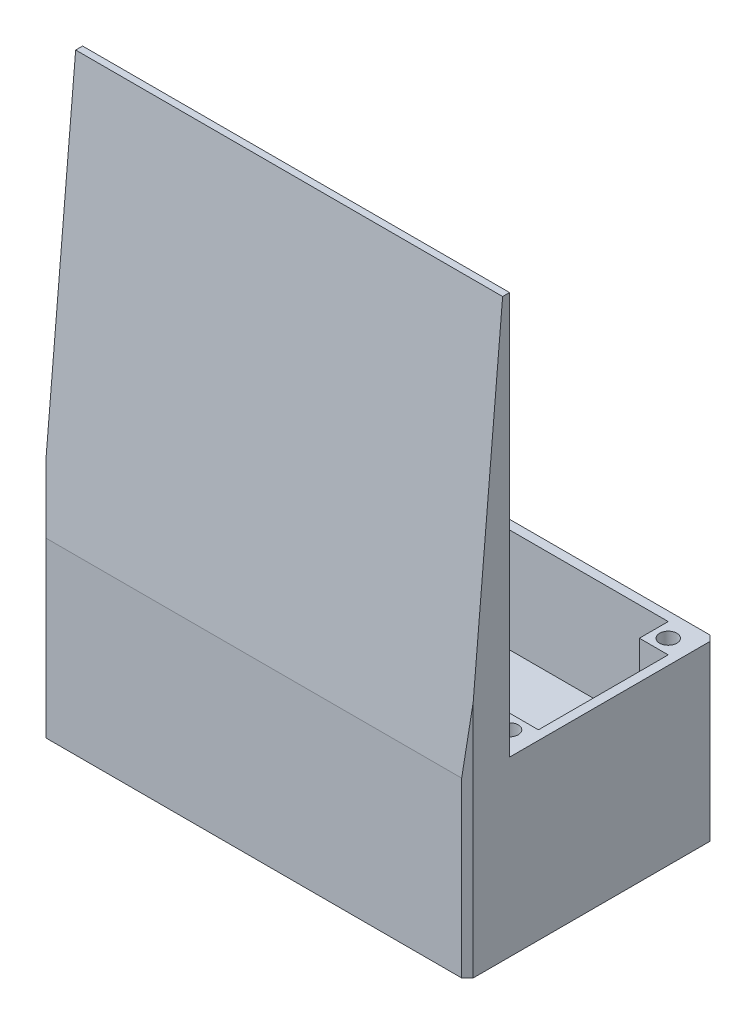
from build123d import *

# Parameters (mm, degrees)
SKETCH_1_W          = 74
SKETCH_1_H          = 43
EXTRUDE_1_DEPTH     = 30
EXTRUDE_4_DEPTH     = 74
CUT_EXTRUDE_2_REACH = 115.492
SKETCH_8_W          = 67
SKETCH_8_H          = 67
SKETCH_10_W         = 70.8
SKETCH_10_H         = 32.499098008
CUT_EXTRUDE_3_DEPTH = 18
CUT_EXTRUDE_5_REACH = 114.206
SKETCH_11_W         = 67
SKETCH_11_H         = 1.389705156
SKETCH_12_W         = 5
SKETCH_12_H         = 5
SKETCH_12_R         = 1.5
EXTRUDE_6_DEPTH     = 18
CHAMFER_1_SIZE      = 1


with BuildPart() as part:
    # 草图1 → 凸台-拉伸1 (new body)
    with BuildSketch(Plane(origin=(0, 0, 0), x_dir=(1, 0, 0), z_dir=(0, 1, 0))):
        Rectangle(SKETCH_1_W, SKETCH_1_H)
    extrude(amount=EXTRUDE_1_DEPTH)

    # 草图7 → 凸台-拉伸4 (add, through all)
    with BuildSketch(Plane.ZY.offset(37)):
        Polygon((21.5, 30), (15.399098008, 99.733628866), (14.199098008, 99.733628866), (14.199098008, 30), align=None)
    extrude(amount=-EXTRUDE_4_DEPTH)

    # 切除-拉伸2: up to this plane
    cut_extrude_2_end = Plane(origin=(37, 99.733628866, 14.199098008), z_dir=(0, 0, -1))
    # 草图8 → 切除-拉伸2 (cut, up to the surface)
    with BuildSketch(Plane(origin=(0, 1.990014723, 22.745972372), x_dir=(1, 0, 0), z_dir=(0, 0.08715574274766194, 0.9961946980917453)), mode=Mode.PRIVATE) as cut_extrude_2_sk1:
        with Locations((0, 63.011992474)):
            Rectangle(SKETCH_8_W, SKETCH_8_H)
    cut_extrude_2_tool1 = split(extrude(cut_extrude_2_sk1.sketch, amount=-CUT_EXTRUDE_2_REACH, mode=Mode.PRIVATE), bisect_by=cut_extrude_2_end, keep=Keep.BOTH, mode=Mode.PRIVATE)
    add(cut_extrude_2_tool1.solids().sort_by_distance((0, 64.762228, 17.254115))[0], mode=Mode.SUBTRACT)

    # 草图10 → 切除-拉伸3 (cut)
    with BuildSketch(Plane(origin=(0, 30, 0), x_dir=(1, 0, 0), z_dir=(0, 1, 0))):
        with Locations((0, 3.650450996)):
            Rectangle(SKETCH_10_W, SKETCH_10_H)
    extrude(amount=-CUT_EXTRUDE_3_DEPTH, mode=Mode.SUBTRACT)

    # 切除-拉伸5: up to this face of the body (flat: up to its plane)
    cut_extrude_5_end = Plane(part.part.faces().sort_by_distance((0, 64.762227542, 17.254115366))[0])
    # 草图11 → 切除-拉伸5 (cut, up to the picked face)
    with BuildSketch(Plane(origin=(0, 0, 14.199098008), x_dir=(-1, 0, 0), z_dir=(0, 0, -1)), mode=Mode.PRIVATE) as cut_extrude_5_sk1:
        with Locations((0, 30.694852578)):
            Rectangle(SKETCH_11_W, SKETCH_11_H)
    cut_extrude_5_tool1 = split(extrude(cut_extrude_5_sk1.sketch, amount=-CUT_EXTRUDE_5_REACH, mode=Mode.PRIVATE), bisect_by=cut_extrude_5_end, keep=Keep.BOTH, mode=Mode.PRIVATE)
    add(cut_extrude_5_tool1.solids().sort_by(Axis((0, 30.694853, 14.199098), (0, 0, 1)))[0], mode=Mode.SUBTRACT)

    # 草图12 → 凸台-拉伸6 (add)
    # profile 1 of 4: a face of its own
    with BuildSketch(Plane(origin=(0, 12, 0), x_dir=(1, 0, 0), z_dir=(0, 1, 0))):
        with Locations((-32.9, 17.4)):
            Rectangle(SKETCH_12_W, SKETCH_12_H)
        with Locations(Location((-32.904560765, 17.513886845, 0), (0, 0, 90))):
            Circle(SKETCH_12_R, mode=Mode.SUBTRACT)
    # profile 2 of 4: a face of its own
    with BuildSketch(Plane(origin=(0, 12, 0), x_dir=(1, 0, 0), z_dir=(0, 1, 0))):
        with Locations((32.9, 17.4)):
            Rectangle(SKETCH_12_W, SKETCH_12_H)
        with Locations(Location((32.9, 17.4, 0), (0, 0, 90))):
            Circle(SKETCH_12_R, mode=Mode.SUBTRACT)
    # profile 3 of 4: a face of its own
    with BuildSketch(Plane(origin=(0, 12, 0), x_dir=(1, 0, 0), z_dir=(0, 1, 0))):
        with Locations((-32.9, -10.099098008)):
            Rectangle(SKETCH_12_W, SKETCH_12_H)
        with Locations(Location((-32.9, -10.099098008, 0), (0, 0, 90))):
            Circle(SKETCH_12_R, mode=Mode.SUBTRACT)
    # profile 4 of 4: a face of its own
    with BuildSketch(Plane(origin=(0, 12, 0), x_dir=(1, 0, 0), z_dir=(0, 1, 0))):
        with Locations((32.9, -10.099098008)):
            Rectangle(SKETCH_12_W, SKETCH_12_H)
        with Locations(Location((32.9, -10.099098008, 0), (0, 0, 90))):
            Circle(SKETCH_12_R, mode=Mode.SUBTRACT)
    extrude(amount=EXTRUDE_6_DEPTH)

    # 倒角1
    # the kernel refuses this chamfer: 1 mm, written as the material it takes off along each edge
    with BuildSketch(Plane(origin=(37, -2.571682988, 21.5), x_dir=(0, 0, -1), z_dir=(0, 1, 0))) as chamfer_1_piece_1:
        Polygon((CHAMFER_1_SIZE, 0), (0, CHAMFER_1_SIZE), (0, 0), align=None)
    extrude(amount=45.430097928, mode=Mode.SUBTRACT)
    with BuildSketch(Plane(origin=(-37, -2.571682988, 21.5), x_dir=(0, 0, -1), z_dir=(0, 1, 0))) as chamfer_1_piece_2:
        Polygon((CHAMFER_1_SIZE, 0), (0, -CHAMFER_1_SIZE), (0, 0), align=None)
    extrude(amount=45.430097928, mode=Mode.SUBTRACT)
    with BuildSketch(Plane(origin=(-37, -2.571682988, -21.5), x_dir=(1, 0, 0), z_dir=(0, 1, 0))) as chamfer_1_piece_3:
        Polygon((CHAMFER_1_SIZE, 0), (0, -CHAMFER_1_SIZE), (0, 0), align=None)
    extrude(amount=35.143365976, mode=Mode.SUBTRACT)
    with BuildSketch(Plane(origin=(37, -2.571682988, -21.5), x_dir=(-1, 0, 0), z_dir=(0, 1, 0))) as chamfer_1_piece_4:
        Polygon((CHAMFER_1_SIZE, 0), (0, CHAMFER_1_SIZE), (0, 0), align=None)
    extrude(amount=35.143365976, mode=Mode.SUBTRACT)


solid = part.part
